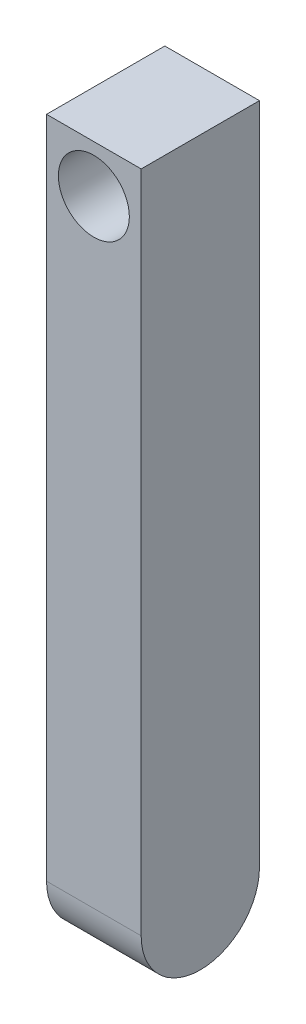
from build123d import *

# Parameters (mm, degrees)
SKETCH1_W           = 80
SKETCH1_H           = 611.5
SKETCH1_R           = 30
BOSS_EXTRUDE1_DEPTH = 100
FILLET2_R           = 50


with BuildPart() as part:
    # Sketch1 → Boss-Extrude1 (new body)
    with BuildSketch(Plane.XY):
        with Locations((2.330379174, 234.720418357)):
            Rectangle(SKETCH1_W, SKETCH1_H)
        with Locations((2.330379174, 500.470418357)):
            Circle(SKETCH1_R, mode=Mode.SUBTRACT)
    extrude(amount=BOSS_EXTRUDE1_DEPTH)

    # Fillet2
    fillet2_edges = [part.edges().sort_by_distance(p)[0] for p in [
        (2.330379174, -71.029581643, 0),
        (2.330379174, -71.029581643, 100),
    ]]
    fillet(fillet2_edges, radius=FILLET2_R - 0.0001)  # a hair under: the kernel refuses the full size


solid = part.part
